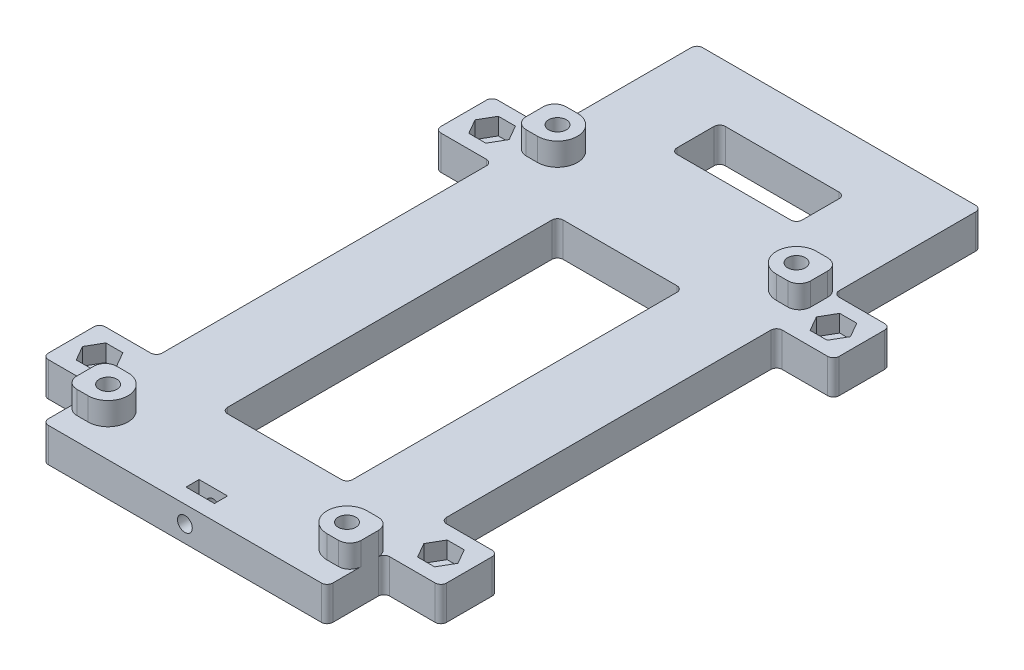
from build123d import *
from build123d.topology import SkipClean

# Parameters (mm, degrees)
SKETCH1_W               = 50
SKETCH1_H               = 115
SKETCH1_R               = 1.55
BOSS_EXTRUDE1_DEPTH     = 6
SKETCH2_R               = 3.25
CUT_EXTRUDE1_DEPTH      = 4.5
BOSS_EXTRUDE2_DEPTH     = 4
SKETCH4_W               = 10
SKETCH4_H               = 10
BOSS_EXTRUDE3_DEPTH     = 6
SKETCH5_R               = 1.25
CUT_EXTRUDE2_DEPTH      = 6
CUT_EXTRUDE3_DEPTH      = 68.581432361
CUT_EXTRUDE3_DEPTH_BACK = 68.581432361
SKETCH6_W               = 22
SKETCH6_H               = 59
SKETCH6_H_2             = 8.5
SKETCH7_R               = 1.3
CUT_EXTRUDE4_DEPTH      = 25
CUT_EXTRUDE5_DEPTH      = 68.581432361
CUT_EXTRUDE5_DEPTH_BACK = 68.581432361
SKETCH8_W               = 5
SKETCH8_H               = 2.3
CUT_EXTRUDE6_DEPTH      = 3
FILLET1_R               = 1
FILLET2_START           = 6
FILLET2_DEPTH           = 5


with BuildPart() as part:
    # Sketch1 → Boss-Extrude1 (new body)
    with BuildSketch(Plane(origin=(0, 0, 0), x_dir=(1, 0, 0), z_dir=(0, 1, 0))):
        Rectangle(SKETCH1_W, SKETCH1_H)
        with Locations(Location((-21, 29, 0), (0, 0, 270))):
            Circle(SKETCH1_R, mode=Mode.SUBTRACT)
        with Locations(Location((21, 29, 0), (0, 0, 270))):
            Circle(SKETCH1_R, mode=Mode.SUBTRACT)
        with Locations(Location((21, -50, 0), (0, 0, 270))):
            Circle(SKETCH1_R, mode=Mode.SUBTRACT)
        with Locations(Location((-21, -50, 0), (0, 0, 270))):
            Circle(SKETCH1_R, mode=Mode.SUBTRACT)
    extrude(amount=BOSS_EXTRUDE1_DEPTH)

    # Sketch2 → Cut-Extrude1 (cut)
    with BuildSketch(Plane.XZ):
        with Locations(Location((-21, 50, 0), (0, 0, 270))):
            Circle(SKETCH2_R)
        with Locations(Location((21, 50, 0), (0, 0, 270))):
            Circle(SKETCH2_R)
        with Locations(Location((21, -29, 0), (0, 0, 270))):
            Circle(SKETCH2_R)
        with Locations(Location((-21, -29, 0), (0, 0, 270))):
            Circle(SKETCH2_R)
    extrude(amount=-CUT_EXTRUDE1_DEPTH, mode=Mode.SUBTRACT)

    # Sketch3 → Boss-Extrude2 (add)
    with SkipClean():  # the faces are left unmerged after this step: merging them gives an invalid solid
        with BuildSketch(Plane(origin=(0, 6, 0), x_dir=(1, 0, 0), z_dir=(0, 1, 0))):
            with BuildLine():
                ThreePointArc((-21, 25.5), (-24.5, 29), (-21, 32.5))
                Line((-21, 32.5), (-25, 32.5))
                Line((-25, 32.5), (-25, 25.5))
                Line((-25, 25.5), (-21, 25.5))
            make_face()
            with BuildLine():
                ThreePointArc((-17.5, 29), (-18.525126266, 31.474873734), (-21, 32.5))
                Line((-21, 32.5), (-21, 30.55))
                ThreePointArc((-21, 30.55), (-19.903984489, 30.096015511), (-19.45, 29))
                ThreePointArc((-19.45, 29), (-19.903984489, 27.903984489), (-21, 27.45))
                Line((-21, 27.45), (-21, 25.5))
                ThreePointArc((-21, 25.5), (-18.525126266, 26.525126266), (-17.5, 29))
            make_face()
            with BuildLine():
                Line((-21, 30.55), (-21, 32.5))
                ThreePointArc((-21, 32.5), (-24.5, 29), (-21, 25.5))
                Line((-21, 25.5), (-21, 27.45))
                ThreePointArc((-21, 27.45), (-22.55, 29), (-21, 30.55))
            make_face()
            with BuildLine():
                ThreePointArc((24.5, 29), (23.474873734, 31.474873734), (21, 32.5))
                Line((21, 32.5), (21, 30.55))
                ThreePointArc((21, 30.55), (22.096015511, 30.096015511), (22.55, 29))
                ThreePointArc((22.55, 29), (22.096015511, 27.903984489), (21, 27.45))
                Line((21, 27.45), (21, 25.5))
                ThreePointArc((21, 25.5), (23.474873734, 26.525126266), (24.5, 29))
            make_face()
            with BuildLine():
                Line((21, 30.55), (21, 32.5))
                ThreePointArc((21, 32.5), (17.5, 29), (21, 25.5))
                Line((21, 25.5), (21, 27.45))
                ThreePointArc((21, 27.45), (19.45, 29), (21, 30.55))
            make_face()
            with BuildLine():
                Line((25, 32.5), (21, 32.5))
                ThreePointArc((21, 32.5), (23.474873734, 31.474873734), (24.5, 29))
                ThreePointArc((24.5, 29), (23.474873734, 26.525126266), (21, 25.5))
                Line((21, 25.5), (25, 25.5))
                Line((25, 25.5), (25, 32.5))
            make_face()
            with BuildLine():
                Line((25, -53.5), (25, -46.5))
                Line((25, -46.5), (21, -46.5))
                ThreePointArc((21, -46.5), (23.474873734, -47.525126266), (24.5, -50))
                ThreePointArc((24.5, -50), (23.474873734, -52.474873734), (21, -53.5))
                Line((21, -53.5), (25, -53.5))
            make_face()
            with BuildLine():
                ThreePointArc((24.5, -50), (23.474873734, -47.525126266), (21, -46.5))
                Line((21, -46.5), (21, -48.45))
                ThreePointArc((21, -48.45), (22.096015511, -48.903984489), (22.55, -50))
                ThreePointArc((22.55, -50), (22.096015511, -51.096015511), (21, -51.55))
                Line((21, -51.55), (21, -53.5))
                ThreePointArc((21, -53.5), (23.474873734, -52.474873734), (24.5, -50))
            make_face()
            with BuildLine():
                Line((21, -48.45), (21, -46.5))
                ThreePointArc((21, -46.5), (17.5, -50), (21, -53.5))
                Line((21, -53.5), (21, -51.55))
                ThreePointArc((21, -51.55), (19.45, -50), (21, -48.45))
            make_face()
            with BuildLine():
                ThreePointArc((-17.5, -50), (-18.525126266, -47.525126266), (-21, -46.5))
                Line((-21, -46.5), (-21, -48.45))
                ThreePointArc((-21, -48.45), (-19.903984489, -48.903984489), (-19.45, -50))
                ThreePointArc((-19.45, -50), (-19.903984489, -51.096015511), (-21, -51.55))
                Line((-21, -51.55), (-21, -53.5))
                ThreePointArc((-21, -53.5), (-18.525126266, -52.474873734), (-17.5, -50))
            make_face()
            with BuildLine():
                Line((-21, -48.45), (-21, -46.5))
                ThreePointArc((-21, -46.5), (-24.5, -50), (-21, -53.5))
                Line((-21, -53.5), (-21, -51.55))
                ThreePointArc((-21, -51.55), (-22.55, -50), (-21, -48.45))
            make_face()
            with BuildLine():
                Line((-21, -46.5), (-25, -46.5))
                Line((-25, -46.5), (-25, -53.5))
                Line((-25, -53.5), (-21, -53.5))
                ThreePointArc((-21, -53.5), (-24.5, -50), (-21, -46.5))
            make_face()
        extrude(amount=BOSS_EXTRUDE2_DEPTH)

    # Sketch4 → Boss-Extrude3 (add)
    with SkipClean():  # the faces are left unmerged after this step: merging them gives an invalid solid
        with BuildSketch(Plane.XZ):
            with Locations((-30, 42.5)):
                Rectangle(SKETCH4_W, SKETCH4_H)
            with Locations((-30, -26.5)):
                Rectangle(SKETCH4_W, SKETCH4_H)
            with Locations((30, -26.5)):
                Rectangle(SKETCH4_W, SKETCH4_H)
            with Locations((30, 42.5)):
                Rectangle(SKETCH4_W, SKETCH4_H)
        extrude(amount=-BOSS_EXTRUDE3_DEPTH)

    # Sketch5 → Cut-Extrude2 (cut)
    with SkipClean():  # the faces are left unmerged after this step: merging them gives an invalid solid
        with BuildSketch(Plane(origin=(0, 6, 0), x_dir=(1, 0, 0), z_dir=(0, 1, 0))):
            with Locations(Location((-30, 26.5, 0), (0, 0, 270))):
                Circle(SKETCH5_R)
            with Locations(Location((30, 26.5, 0), (0, 0, 270))):
                Circle(SKETCH5_R)
            with Locations(Location((30, -42.5, 0), (0, 0, 270))):
                Circle(SKETCH5_R)
            with Locations(Location((-30, -42.5, 0), (0, 0, 270))):
                Circle(SKETCH5_R)
        extrude(amount=-CUT_EXTRUDE2_DEPTH, mode=Mode.SUBTRACT)

    # Sketch6 → Cut-Extrude3 (cut, two sides: drawn at the far end of the back side and taken through both)
    with SkipClean():  # the faces are left unmerged after this step: merging them gives an invalid solid
        with BuildSketch(Plane(origin=(0, 6, 0), x_dir=(1, 0, 0), z_dir=(0, 1, 0)).offset(-CUT_EXTRUDE3_DEPTH_BACK)):
            with Locations((0, -10.5)):
                Rectangle(SKETCH6_W, SKETCH6_H)
            with Locations((0, 43.25)):
                Rectangle(SKETCH6_W, SKETCH6_H_2)
        extrude(amount=CUT_EXTRUDE3_DEPTH + CUT_EXTRUDE3_DEPTH_BACK, mode=Mode.SUBTRACT)

    # Sketch7 → Cut-Extrude4 (cut)
    with SkipClean():  # the faces are left unmerged after this step: merging them gives an invalid solid
        with BuildSketch(Plane.XY.offset(57.5)):
            with Locations((0, 3)):
                Circle(SKETCH7_R)
        extrude(amount=-CUT_EXTRUDE4_DEPTH, mode=Mode.SUBTRACT)

    # Sketch8 → Cut-Extrude5 (cut, two sides: drawn at the far end of the back side and taken through both)
    with SkipClean():  # the faces are left unmerged after this step: merging them gives an invalid solid
        with BuildSketch(Plane(origin=(0, 6, 0), x_dir=(1, 0, 0), z_dir=(0, 1, 0)).offset(-CUT_EXTRUDE5_DEPTH_BACK)):
            with Locations((0, -53.65)):
                Rectangle(SKETCH8_W, SKETCH8_H)
        extrude(amount=CUT_EXTRUDE5_DEPTH + CUT_EXTRUDE5_DEPTH_BACK, mode=Mode.SUBTRACT)

    # Sketch9 → Cut-Extrude6 (cut)
    with SkipClean():  # the faces are left unmerged after this step: merging them gives an invalid solid
        with BuildSketch(Plane(origin=(0, 6, 0), x_dir=(1, 0, 0), z_dir=(0, 1, 0))):
            Polygon((-27, 26.5), (-28.5, 29.098076211), (-31.5, 29.098076211), (-33, 26.5), (-31.5, 23.901923789), (-28.5, 23.901923789), align=None)
            Polygon((33, 26.5), (31.5, 29.098076211), (28.5, 29.098076211), (27, 26.5), (28.5, 23.901923789), (31.5, 23.901923789), align=None)
            Polygon((33, -42.5), (31.5, -39.901923789), (28.5, -39.901923789), (27, -42.5), (28.5, -45.098076211), (31.5, -45.098076211), align=None)
            Polygon((-27, -42.5), (-28.5, -39.901923789), (-31.5, -39.901923789), (-33, -42.5), (-31.5, -45.098076211), (-28.5, -45.098076211), align=None)
        extrude(amount=-CUT_EXTRUDE6_DEPTH, mode=Mode.SUBTRACT)

    # Fillet1
    # the kernel refuses this fillet: 1 mm, written as the material it adds along each edge
    with BuildSketch(Plane(origin=(-25, 0, 47.5), x_dir=(0, 0, 1), z_dir=(0, 1, 0)), Plane(origin=(-25, 0, -21.5), x_dir=(0, 0, 1), z_dir=(0, 1, 0)), Plane(origin=(25, 0, -31.5), x_dir=(0, 0, -1), z_dir=(0, 1, 0)), Plane(origin=(25, 0, 37.5), x_dir=(0, 0, -1), z_dir=(0, 1, 0)), Plane(origin=(11, 6, -19), x_dir=(-1, 0, 0), z_dir=(0, -1, 0)), Plane(origin=(11, 6, 40), x_dir=(0, 0, -1), z_dir=(0, -1, 0)), Plane(origin=(-11, 0, 40), x_dir=(0, 0, -1), z_dir=(0, 1, 0)), Plane(origin=(-11, 0, -19), x_dir=(1, 0, 0), z_dir=(0, 1, 0)), Plane(origin=(11, 6, -47.5), x_dir=(-1, 0, 0), z_dir=(0, -1, 0)), Plane(origin=(11, 6, -39), x_dir=(0, 0, -1), z_dir=(0, -1, 0)), Plane(origin=(-11, 0, -39), x_dir=(0, 0, -1), z_dir=(0, 1, 0)), Plane(origin=(-11, 0, -47.5), x_dir=(1, 0, 0), z_dir=(0, 1, 0))) as fillet1_piece_1:
        with BuildLine():
            CenterArc((FILLET1_R, -FILLET1_R), FILLET1_R, 90, 90)
            Line((0, -FILLET1_R), (0, 0))
            Line((0, 0), (FILLET1_R, 0))
        make_face()
    extrude(amount=6)
    with BuildSketch(Plane(origin=(-25, 0, 37.5), x_dir=(0, 0, -1), z_dir=(0, 1, 0)), Plane(origin=(-25, 0, -31.5), x_dir=(0, 0, -1), z_dir=(0, 1, 0)), Plane(origin=(25, 0, -21.5), x_dir=(0, 0, 1), z_dir=(0, 1, 0)), Plane(origin=(25, 0, 47.5), x_dir=(0, 0, 1), z_dir=(0, 1, 0))) as fillet1_piece_2:
        with BuildLine():
            CenterArc((FILLET1_R, FILLET1_R), FILLET1_R, 180, 90)
            Line((0, FILLET1_R), (0, 0))
            Line((0, 0), (FILLET1_R, 0))
        make_face()
    extrude(amount=6)
    # the kernel refuses this fillet: 1 mm, written as the material it takes off along each edge
    with BuildSketch(Plane(origin=(-35, -2.5, 37.5), x_dir=(0, 0, 1), z_dir=(0, 1, 0)), Plane(origin=(-35, -2.5, 47.5), x_dir=(1, 0, 0), z_dir=(0, 1, 0)), Plane(origin=(35, -2.5, -31.5), x_dir=(-1, 0, 0), z_dir=(0, 1, 0)), Plane(origin=(25, -2.5, 57.5), x_dir=(0, 0, -1), z_dir=(0, 1, 0)), Plane(origin=(25, -2.5, -57.5), x_dir=(-1, 0, 0), z_dir=(0, 1, 0))) as fillet1_2_piece_1:
        with BuildLine():
            CenterArc((FILLET1_R, FILLET1_R), FILLET1_R, 180, 90)
            Line((0, FILLET1_R), (0, 0))
            Line((0, 0), (FILLET1_R, 0))
        make_face()
    extrude(amount=11, mode=Mode.SUBTRACT)
    with BuildSketch(Plane(origin=(-35, -2.5, -31.5), x_dir=(1, 0, 0), z_dir=(0, 1, 0)), Plane(origin=(-35, -2.5, -21.5), x_dir=(0, 0, -1), z_dir=(0, 1, 0)), Plane(origin=(35, -2.5, -21.5), x_dir=(-1, 0, 0), z_dir=(0, 1, 0)), Plane(origin=(35, -2.5, 47.5), x_dir=(-1, 0, 0), z_dir=(0, 1, 0)), Plane(origin=(35, -2.5, 37.5), x_dir=(0, 0, 1), z_dir=(0, 1, 0)), Plane(origin=(-25, -2.5, 57.5), x_dir=(0, 0, -1), z_dir=(0, 1, 0)), Plane(origin=(-25, -2.5, -57.5), x_dir=(1, 0, 0), z_dir=(0, 1, 0))) as fillet1_2_piece_2:
        with BuildLine():
            CenterArc((FILLET1_R, -FILLET1_R), FILLET1_R, 90, 90)
            Line((0, -FILLET1_R), (0, 0))
            Line((0, 0), (FILLET1_R, 0))
        make_face()
    extrude(amount=11, mode=Mode.SUBTRACT)

    # Fillet2: read off the stored shape, not the designer's step
    # Fillet2 outline → Fillet2 (cut)
    with BuildSketch(Plane(origin=(0, 0, 0), x_dir=(1, 0, 0), z_dir=(0, 1, 0)).offset(FILLET2_START)):
        with BuildLine():
            Line((25, 25.5), (25, 27.5))
            ThreePointArc((25, 27.5), (24.414213562, 26.085786438), (23, 25.5))
            Line((23, 25.5), (25, 25.5))
        make_face()
        with BuildLine():
            ThreePointArc((23, 32.5), (24.414213562, 31.914213562), (25, 30.5))
            Line((25, 30.5), (25, 32.5))
            Line((25, 32.5), (23, 32.5))
        make_face()
        with BuildLine():
            Line((25, -53.5), (25, -51.5))
            ThreePointArc((25, -51.5), (24.414213562, -52.914213562), (23, -53.5))
            Line((23, -53.5), (25, -53.5))
        make_face()
        with BuildLine():
            ThreePointArc((23, -46.5), (24.414213562, -47.085786438), (25, -48.5))
            Line((25, -48.5), (25, -46.5))
            Line((25, -46.5), (23, -46.5))
        make_face()
        with BuildLine():
            ThreePointArc((-23, -53.5), (-24.414213562, -52.914213562), (-25, -51.5))
            Line((-25, -51.5), (-25, -53.5))
            Line((-25, -53.5), (-23, -53.5))
        make_face()
        with BuildLine():
            Line((-25, -46.5), (-25, -48.5))
            ThreePointArc((-25, -48.5), (-24.414213562, -47.085786438), (-23, -46.5))
            Line((-23, -46.5), (-25, -46.5))
        make_face()
        with BuildLine():
            ThreePointArc((-23, 25.5), (-24.414213562, 26.085786438), (-25, 27.5))
            Line((-25, 27.5), (-25, 25.5))
            Line((-25, 25.5), (-23, 25.5))
        make_face()
        with BuildLine():
            Line((-25, 32.5), (-25, 30.5))
            ThreePointArc((-25, 30.5), (-24.414213562, 31.914213562), (-23, 32.5))
            Line((-23, 32.5), (-25, 32.5))
        make_face()
    extrude(amount=FILLET2_DEPTH, mode=Mode.SUBTRACT)


solid = part.part
